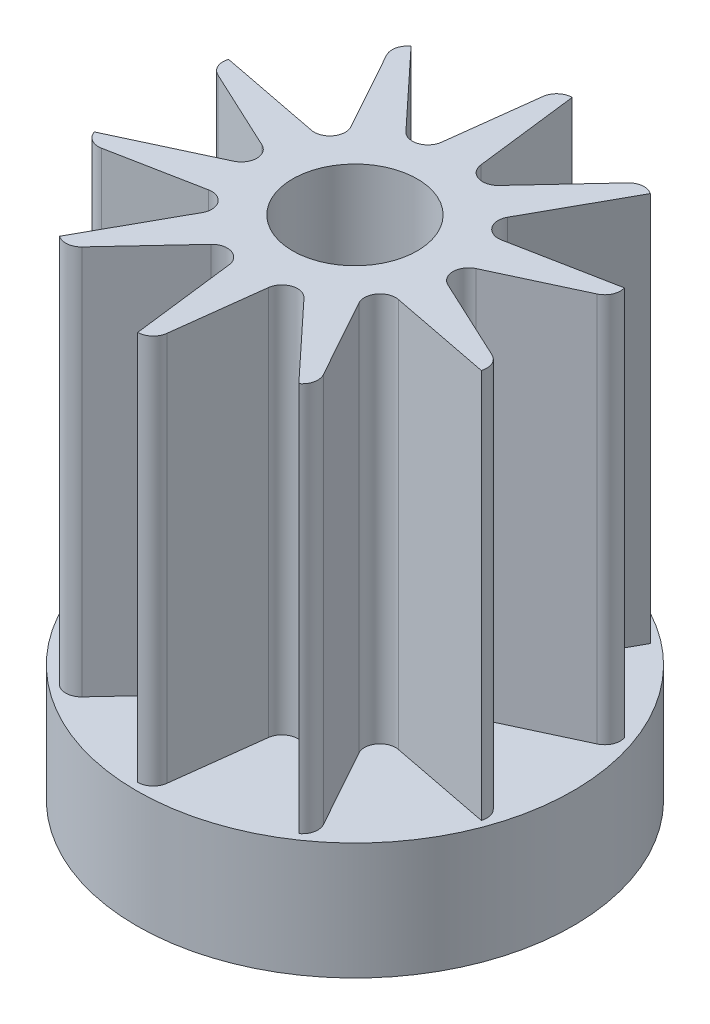
from build123d import *

# Parameters (mm, degrees)
CUT_EXTRUDE1_DEPTH = 2.5
FILLET1_R          = 0.1
CIRPATTERN1_START  = 0.75
CIRPATTERN1_DEPTH  = 2.5


# Read off the part's stored shape, not the designer's step: CirPattern1
with BuildPart() as part:
    # Sketch1 → Revolve1 (revolve)
    with BuildSketch(Plane.XY, mode=Mode.PRIVATE) as revolve1_sk:
        Polygon((0.4, 0), (0.4, 3.25), (1.35, 3.25), (1.35, 0.75), (1.4, 0.75), (1.4, 0), align=None)
    revolve(revolve1_sk.sketch.rotate(Axis((0, 55, 0), (0, -1, 0)), 90), axis=Axis((0, 55, 0), (0, -1, 0)))

    # Sketch2 → Cut-Extrude1 (cut)
    with BuildSketch(Plane(origin=(0, 3.25, 0), x_dir=(1, 0, 0), z_dir=(0, 1, 0))):
        Polygon((1.296871235, 0.375), (0.49268114, 0), (1.296871235, -0.375), (1.471211197, -0.375), (1.471211197, 0.375), align=None)
    extrude(amount=-CUT_EXTRUDE1_DEPTH, mode=Mode.SUBTRACT)

    # Fillet1
    fillet1_edges = [part.edges().sort_by_distance(p)[0] for p in [
        (0.49268114, 2, 0),
        (1.296871235, 2, 0.375),
        (1.296871235, 2, -0.375),
    ]]
    fillet(fillet1_edges, radius=FILLET1_R)

    # CirPattern1 outline → CirPattern1 (cut)
    with BuildSketch(Plane(origin=(0, 0, 0), x_dir=(1, 0, 0), z_dir=(0, 1, 0)).offset(CIRPATTERN1_START)):
        with BuildLine():
            ThreePointArc((1.268314657, -0.462469385), (1.268946471, -0.460684309), (1.269544372, -0.45888759))
            Line((1.269544372, -0.45888759), (0.609098044, -0.330509829))
            ThreePointArc((0.609098044, -0.330509829), (0.509115445, -0.369894022), (0.502555173, -0.47715351))
            Line((0.502555173, -0.47715351), (0.785879225, -0.988283629))
            ThreePointArc((0.785879225, -0.988283629), (0.796074313, -1.058284325), (0.757401445, -1.117516466))
            ThreePointArc((0.757401445, -1.117516466), (1.064496642, -0.830269173), (1.268314657, -0.462469385))
        make_face()
        with BuildLine():
            ThreePointArc((1.268314657, 0.462469385), (1.091055986, 0.795045179), (0.828771399, 1.065663159))
            Line((0.828771399, 1.065663159), (0.502555173, 0.47715351))
            ThreePointArc((0.502555173, 0.47715351), (0.509115445, 0.369894022), (0.609098044, 0.330509829))
            Line((0.609098044, 0.330509829), (1.269544372, 0.45888759))
            ThreePointArc((1.269544372, 0.45888759), (1.268946471, 0.460684309), (1.268314657, 0.462469385))
        make_face()
        with BuildLine():
            ThreePointArc((0.828771399, 1.065663159), (0.458900413, 1.269610338), (0.044109058, 1.349279212))
            Line((0.044109058, 1.349279212), (0.12611188, 0.681419818))
            ThreePointArc((0.12611188, 0.681419818), (0.194464795, 0.5985011), (0.298501865, 0.625406916))
            Line((0.298501865, 0.625406916), (0.697063549, 1.052811995))
            ThreePointArc((0.697063549, 1.052811995), (0.760487712, 1.084139504), (0.828771399, 1.065663159))
        make_face()
        with BuildLine():
            ThreePointArc((0.044109058, 1.349279212), (-0.375, 1.296871235), (-0.757401445, 1.117516466))
            Line((-0.757401445, 1.117516466), (-0.298501865, 0.625406916))
            ThreePointArc((-0.298501865, 0.625406916), (-0.194464795, 0.5985011), (-0.12611188, 0.681419818))
            Line((-0.12611188, 0.681419818), (-0.054891106, 1.26146647))
            ThreePointArc((-0.054891106, 1.26146647), (-0.021993729, 1.324090745), (0.044109058, 1.349279212))
        make_face()
        with BuildLine():
            ThreePointArc((-0.757401445, 1.117516466), (-1.065663159, 0.828771399), (-1.269610338, 0.458900413))
            Line((-1.269610338, 0.458900413), (-0.609098044, 0.330509829))
            ThreePointArc((-0.609098044, 0.330509829), (-0.509115445, 0.369894022), (-0.502555173, 0.47715351))
            Line((-0.502555173, 0.47715351), (-0.785879225, 0.988283629))
            ThreePointArc((-0.785879225, 0.988283629), (-0.796074313, 1.058284325), (-0.757401445, 1.117516466))
        make_face()
        with BuildLine():
            ThreePointArc((-1.269610338, 0.458900413), (-1.349279212, 0.044109057), (-1.296871235, -0.375))
            Line((-1.296871235, -0.375), (-0.687039472, -0.090630779))
            ThreePointArc((-0.687039472, -0.090630779), (-0.629301298, 0), (-0.687039472, 0.090630779))
            Line((-0.687039472, 0.090630779), (-1.216688191, 0.337610032))
            ThreePointArc((-1.216688191, 0.337610032), (-1.266081567, 0.388249263), (-1.269610338, 0.458900413))
        make_face()
        with BuildLine():
            ThreePointArc((-1.296871235, -0.375), (-1.117516466, -0.757401445), (-0.828771399, -1.065663159))
            Line((-0.828771399, -1.065663159), (-0.502555173, -0.47715351))
            ThreePointArc((-0.502555173, -0.47715351), (-0.509115445, -0.369894022), (-0.609098044, -0.330509829))
            Line((-0.609098044, -0.330509829), (-1.182763621, -0.442019121))
            ThreePointArc((-1.182763621, -0.442019121), (-1.252488695, -0.430083821), (-1.296871235, -0.375))
        make_face()
        with BuildLine():
            ThreePointArc((-0.828771399, -1.065663159), (-0.458900413, -1.269610338), (-0.044109058, -1.349279212))
            Line((-0.044109058, -1.349279212), (-0.12611188, -0.681419818))
            ThreePointArc((-0.12611188, -0.681419818), (-0.194464795, -0.5985011), (-0.298501865, -0.625406916))
            Line((-0.298501865, -0.625406916), (-0.697063549, -1.052811995))
            ThreePointArc((-0.697063549, -1.052811995), (-0.760487712, -1.084139504), (-0.828771399, -1.065663159))
        make_face()
        with BuildLine():
            ThreePointArc((-0.044109058, -1.349279212), (0.375, -1.296871235), (0.757401445, -1.117516466))
            Line((0.757401445, -1.117516466), (0.298501865, -0.625406916))
            ThreePointArc((0.298501865, -0.625406916), (0.194464795, -0.5985011), (0.12611188, -0.681419818))
            Line((0.12611188, -0.681419818), (0.054891106, -1.26146647))
            ThreePointArc((0.054891106, -1.26146647), (0.021993729, -1.324090745), (-0.044109058, -1.349279212))
        make_face()
    extrude(amount=CIRPATTERN1_DEPTH, mode=Mode.SUBTRACT)


solid = part.part
